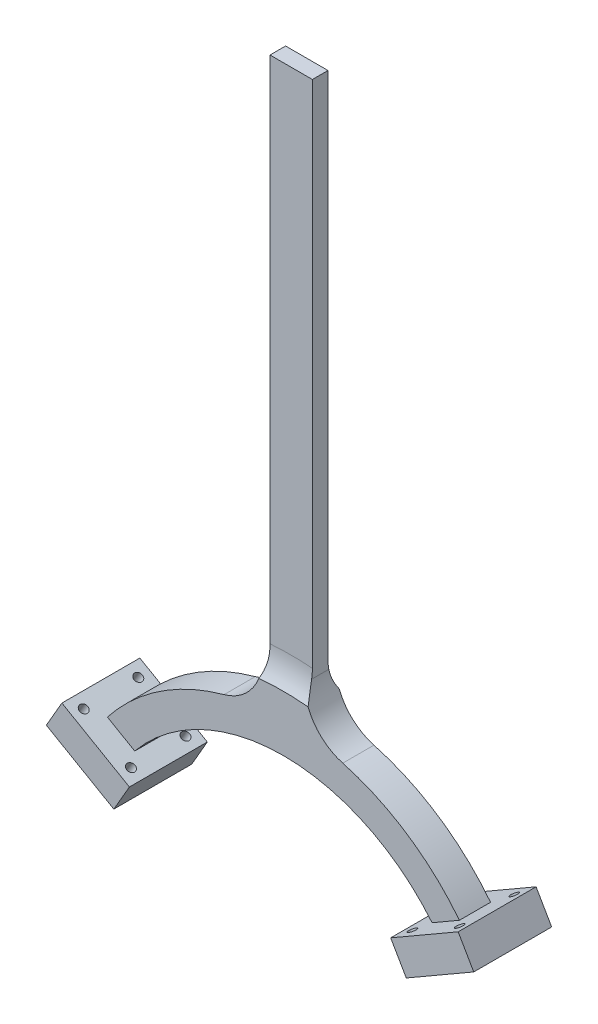
from build123d import *

# Parameters (mm, degrees)
SKETCH1_R                = 8.2
BOSS_EXTRUDE1_DEPTH      = 25
SKETCH2_W                = 40.79
SKETCH2_H                = 15
BOSS_EXTRUDE2_DEPTH      = 25
SKETCH3_R                = 12.5
BOSS_EXTRUDE4_DEPTH      = 25
BOSS_EXTRUDE5_REACH      = 51.448
SKETCH5_W                = 40.79
SKETCH5_H                = 15
BOSS_EXTRUDE7_DEPTH      = 1505
BOSS_EXTRUDE8_START      = -40.79
BOSS_EXTRUDE8_DEPTH      = 40.79
SKETCH9_W                = 15
SKETCH9_H                = 15
REVOLVE1_ANGLE           = 60
REVOLVE1_OTHER_WAY_ANGLE = 60
FILLET3_R                = 50
SKETCH11_W               = 75
SKETCH11_H               = 75
SKETCH11_R               = 4
BOSS_EXTRUDE9_DEPTH      = 30
CUT_EXTRUDE2_DEPTH       = 1755.203433898
SKETCH16_R               = 677.859439882
CUT_EXTRUDE3_DEPTH       = 1049.19413159


with BuildPart() as part:
    # Sketch1 → Boss-Extrude1 (new body)
    with BuildSketch(Plane(origin=(0, 0, 0), x_dir=(1, 0, 0), z_dir=(0, 1, 0))):
        with Locations(Location((0, 0, 0), (0, 0, 270))):
            Circle(SKETCH1_R)
    extrude(amount=BOSS_EXTRUDE1_DEPTH)

    # Sketch2 → Boss-Extrude2 (add)
    with BuildSketch(Plane(origin=(0, 0, 0), x_dir=(-1, 0, 0), z_dir=(0, -1, 0))):
        Rectangle(SKETCH2_W, SKETCH2_H)
    extrude(amount=BOSS_EXTRUDE2_DEPTH)

    # Sketch3 → Boss-Extrude4 (add)
    with BuildSketch(Plane(origin=(0, -25, 0), x_dir=(-1, 0, 0), z_dir=(0, -1, 0))):
        Circle(SKETCH3_R)
    extrude(amount=-BOSS_EXTRUDE4_DEPTH)

    # Boss-Extrude5: up to this face of the body (flat: up to its plane)
    boss_extrude5_end = Plane(part.part.faces().sort_by_distance((20.395, -12.5, 0))[0])
    # Sketch4 → Boss-Extrude5 (add, up to the picked face)
    with BuildSketch(Plane.ZY.offset(20.395), mode=Mode.PRIVATE) as boss_extrude5_sk1:
        Polygon((192.5, -225), (-7.5, -25), (7.5, -25), (207.5, -225), align=None)
    boss_extrude5_tool1 = split(extrude(boss_extrude5_sk1.sketch, amount=-BOSS_EXTRUDE5_REACH, mode=Mode.PRIVATE), bisect_by=boss_extrude5_end, keep=Keep.BOTH, mode=Mode.PRIVATE)
    add(boss_extrude5_tool1.solids().sort_by(Axis((-20.395, -125, 100), (1, 0, 0)))[0])

    # Sketch5 → Boss-Extrude7 (add)
    with BuildSketch(Plane(origin=(0, -225, 0), x_dir=(-1, 0, 0), z_dir=(0, -1, 0))):
        with Locations((0, -200)):
            Rectangle(SKETCH5_W, SKETCH5_H)
    extrude(amount=BOSS_EXTRUDE7_DEPTH)

    # Sketch7 → Boss-Extrude8 (add)
    with BuildSketch(Plane(origin=(20.395, 0, 0), x_dir=(0, 0, -1), z_dir=(1, 0, 0)).offset(BOSS_EXTRUDE8_START)):
        Polygon((1.552099385, -34.052099385), (0, -32.5), (-192.5, -225), (-192.5, -228.104198769), align=None)
        Polygon((7.5, -25), (0, -32.5), (1.552099385, -34.052099385), (7.5, -28.104198769), align=None)
        Polygon((-9.052099385, -23.447900615), (-207.5, -221.895801231), (-207.5, -225), (-7.5, -25), align=None)
        Polygon((-9.052099385, -23.447900615), (-7.5, -25), (-7.5, -21.895801231), align=None)
    extrude(amount=BOSS_EXTRUDE8_DEPTH)

    # Sketch9 → Revolve1 (revolve)
    with BuildSketch(Plane(origin=(0, 0, 0), x_dir=(0, 0, -1), z_dir=(1, 0, 0))):
        with Locations((-207.5, -1522.5)):
            Rectangle(SKETCH9_W, SKETCH9_H)
        Polygon((-185, -1545), (-185, -1530), (-200, -1530), (-215, -1530), (-215, -1545), align=None)
        with Locations((-192.5, -1522.5)):
            Rectangle(SKETCH9_W, SKETCH9_H)
    revolve(axis=Axis((0, -1730, 192.5), (0, 0, 1)), revolution_arc=REVOLVE1_ANGLE)

    # Sketch9 → Revolve1 other way (revolve)
    with BuildSketch(Plane(origin=(0, 0, 0), x_dir=(0, 0, -1), z_dir=(1, 0, 0))):
        with Locations((-207.5, -1522.5)):
            Rectangle(SKETCH9_W, SKETCH9_H)
        Polygon((-185, -1545), (-185, -1530), (-200, -1530), (-215, -1530), (-215, -1545), align=None)
        with Locations((-192.5, -1522.5)):
            Rectangle(SKETCH9_W, SKETCH9_H)
    revolve(axis=Axis((0, -1730, 192.5), (0, 0, -1)), revolution_arc=REVOLVE1_OTHER_WAY_ANGLE)

    # Fillet3
    # the kernel refuses this fillet: 50 mm, written as the material it adds along each edge
    with BuildSketch(Plane(origin=(0, -1730, 207.5), x_dir=(0.6259913130832682, 0.7798300301631668, 0), z_dir=(0.7798300301631668, -0.6259913130832682, 0))) as fillet3_piece_1_section:
        with BuildLine():
            CenterArc((215 + FILLET3_R, FILLET3_R), FILLET3_R, 180, 90)
            Line((215, FILLET3_R), (215, 0))
            Line((215, 0), (215 + FILLET3_R, 0))
        make_face()
    fillet3_piece_1 = revolve(axis=Axis((0, -1730, 207.5), (0, 0, 1)), revolution_arc=77.509968484, mode=Mode.PRIVATE)
    fillet3_piece_1 = split(fillet3_piece_1, bisect_by=Plane(origin=(20.395, -1497.728593149, 210.201005202), z_dir=(-1, 0, 0)), keep=Keep.TOP, mode=Mode.PRIVATE)
    fillet3_piece_1 = split(fillet3_piece_1, bisect_by=Plane(origin=(-20.395, -1497.728593149, 210.201005202), z_dir=(1, 0, 0)), keep=Keep.TOP, mode=Mode.PRIVATE)
    fillet3_piece_1 = split(fillet3_piece_1, bisect_by=Plane(origin=(0, -1497.728593149, 215), z_dir=(0, 0, -1)), keep=Keep.TOP, mode=Mode.PRIVATE)
    add(fillet3_piece_1)
    with BuildSketch(Plane(origin=(-20.395, -1515.969525593, 192.5), x_dir=(-0.9834951946600375, -0.1809342479482942, 0), z_dir=(0, 0, 1))) as fillet3_piece_2:
        with BuildLine():
            CenterArc((41.675293239, -49.811185367), FILLET3_R, 94.980893043, 74.594925131)
            Line((-7.499466494, -40.764472969), (0, 0))
            ThreePointArc((0, 0), (18.66705843, -0.811902923), (37.33411686, 0))
        make_face()
    extrude(amount=15)
    with BuildSketch(Plane(origin=(0, -1730, 192.5), x_dir=(0.6259913130832687, 0.7798300301631664, 0), z_dir=(0.7798300301631664, -0.6259913130832687, 0))) as fillet3_piece_3_section:
        with BuildLine():
            CenterArc((215 + FILLET3_R, -FILLET3_R), FILLET3_R, 90, 90)
            Line((215 + FILLET3_R, 0), (215, 0))
            Line((215, 0), (215, -FILLET3_R))
        make_face()
    fillet3_piece_3 = revolve(axis=Axis((0, -1730, 192.5), (0, 0, 1)), revolution_arc=77.509968484, mode=Mode.PRIVATE)
    fillet3_piece_3 = split(fillet3_piece_3, bisect_by=Plane(origin=(0, -1497.728593149, 185), z_dir=(0, 0, 1)), keep=Keep.TOP, mode=Mode.PRIVATE)
    fillet3_piece_3 = split(fillet3_piece_3, bisect_by=Plane(origin=(-20.395, -1497.728593149, 189.798994798), z_dir=(1, 0, 0)), keep=Keep.TOP, mode=Mode.PRIVATE)
    fillet3_piece_3 = split(fillet3_piece_3, bisect_by=Plane(origin=(20.395, -1497.728593149, 189.798994798), z_dir=(-1, 0, 0)), keep=Keep.TOP, mode=Mode.PRIVATE)
    add(fillet3_piece_3)
    with BuildSketch(Plane(origin=(20.395, -1515.969525593, 192.5), x_dir=(0.9834951946600374, -0.18093424794829469, 0), z_dir=(0, 0, 1))) as fillet3_piece_4:
        with BuildLine():
            CenterArc((41.675293239, 49.811185367), FILLET3_R, 190.424181826, 74.594925131)
            Line((-7.499466494, 40.764472969), (0, 0))
            ThreePointArc((0, 0), (18.66705843, 0.811902923), (37.33411686, 0))
        make_face()
    extrude(amount=15)
    with BuildSketch(Plane(origin=(0, -1730, 207.5), x_dir=(0.6259913130832682, 0.7798300301631668, 0), z_dir=(0.7798300301631668, -0.6259913130832682, 0))) as fillet3_piece_5a_section:
        with BuildLine():
            CenterArc((215 + FILLET3_R, FILLET3_R), FILLET3_R, 180, 90)
            Line((215, FILLET3_R), (215, 0))
            Line((215, 0), (215 + FILLET3_R, 0))
        make_face()
    fillet3_piece_5a = revolve(axis=Axis((0, -1730, 207.5), (0, 0, 1)), revolution_arc=77.509968484, mode=Mode.PRIVATE)
    fillet3_piece_5a = split(fillet3_piece_5a, bisect_by=Plane(origin=(20.395, -1516.663886588, 210.150724115), z_dir=(1, 0, 0)), keep=Keep.TOP, mode=Mode.PRIVATE)
    fillet3_piece_5a = split(fillet3_piece_5a, bisect_by=Plane(origin=(85.698064456, -1516.663886588, 215), z_dir=(0, 0, -1)), keep=Keep.TOP, mode=Mode.PRIVATE)
    with BuildSketch(Plane(origin=(20.395, -1515.969525593, 192.5), x_dir=(0.9834951946600374, -0.18093424794829469, 0), z_dir=(0, 0, 1))) as fillet3_piece_5b_section:
        with BuildLine():
            CenterArc((41.675293239, 49.811185367), FILLET3_R, 190.424181826, 74.594925131)
            Line((-7.499466494, 40.764472969), (0, 0))
            ThreePointArc((0, 0), (18.66705843, 0.811902923), (37.33411686, 0))
        make_face()
    fillet3_piece_5b = extrude(amount=118.621434021, mode=Mode.PRIVATE)
    fillet3_piece_5b = split(fillet3_piece_5b, bisect_by=Plane(origin=(28.539652215, -1507.603520272, 207.5), z_dir=(0, 0, 1)), keep=Keep.TOP, mode=Mode.PRIVATE)
    fillet3_piece_5b = split(fillet3_piece_5b, bisect_by=Plane(origin=(28.539652215, -1507.603520272, 215), z_dir=(0, 0, -1)), keep=Keep.TOP, mode=Mode.PRIVATE)
    fillet3_piece_5 = fillet3_piece_5a & fillet3_piece_5b
    add(fillet3_piece_5)
    with BuildSketch(Plane(origin=(0, -1730, 207.5), x_dir=(0.6259913130832682, 0.7798300301631668, 0), z_dir=(0.7798300301631668, -0.6259913130832682, 0))) as fillet3_piece_6a_section:
        with BuildLine():
            CenterArc((215 + FILLET3_R, FILLET3_R), FILLET3_R, 180, 90)
            Line((215, FILLET3_R), (215, 0))
            Line((215, 0), (215 + FILLET3_R, 0))
        make_face()
    fillet3_piece_6a = revolve(axis=Axis((0, -1730, 207.5), (0, 0, 1)), revolution_arc=77.509968484, mode=Mode.PRIVATE)
    fillet3_piece_6a = split(fillet3_piece_6a, bisect_by=Plane(origin=(-20.395, -1516.663887252, 210.150724175), z_dir=(-1, 0, 0)), keep=Keep.TOP, mode=Mode.PRIVATE)
    fillet3_piece_6a = split(fillet3_piece_6a, bisect_by=Plane(origin=(-85.69806423, -1516.663887252, 215), z_dir=(0, 0, -1)), keep=Keep.TOP, mode=Mode.PRIVATE)
    with BuildSketch(Plane(origin=(-20.395, -1515.969525593, 192.5), x_dir=(-0.9834951946600375, -0.1809342479482942, 0), z_dir=(0, 0, 1))) as fillet3_piece_6b_section:
        with BuildLine():
            CenterArc((41.675293239, -49.811185367), FILLET3_R, 94.980893043, 74.594925131)
            Line((-7.499466494, -40.764472969), (0, 0))
            ThreePointArc((0, 0), (18.66705843, -0.811902923), (37.33411686, 0))
        make_face()
    fillet3_piece_6b = extrude(amount=118.621434021, mode=Mode.PRIVATE)
    fillet3_piece_6b = split(fillet3_piece_6b, bisect_by=Plane(origin=(-28.539652215, -1507.603520272, 207.5), z_dir=(0, 0, 1)), keep=Keep.TOP, mode=Mode.PRIVATE)
    fillet3_piece_6b = split(fillet3_piece_6b, bisect_by=Plane(origin=(-28.539652215, -1507.603520272, 215), z_dir=(0, 0, -1)), keep=Keep.TOP, mode=Mode.PRIVATE)
    fillet3_piece_6 = fillet3_piece_6a & fillet3_piece_6b
    add(fillet3_piece_6)
    with BuildSketch(Plane(origin=(0, -1730, 192.5), x_dir=(0.6259913130832687, 0.7798300301631664, 0), z_dir=(0.7798300301631664, -0.6259913130832687, 0))) as fillet3_piece_7a_section:
        with BuildLine():
            CenterArc((215 + FILLET3_R, -FILLET3_R), FILLET3_R, 90, 90)
            Line((215 + FILLET3_R, 0), (215, 0))
            Line((215, 0), (215, -FILLET3_R))
        make_face()
    fillet3_piece_7a = revolve(axis=Axis((0, -1730, 192.5), (0, 0, 1)), revolution_arc=77.509968484, mode=Mode.PRIVATE)
    fillet3_piece_7a = split(fillet3_piece_7a, bisect_by=Plane(origin=(-85.69806423, -1516.663887252, 185), z_dir=(0, 0, 1)), keep=Keep.TOP, mode=Mode.PRIVATE)
    fillet3_piece_7a = split(fillet3_piece_7a, bisect_by=Plane(origin=(-20.395, -1516.663887252, 189.849275825), z_dir=(-1, 0, 0)), keep=Keep.TOP, mode=Mode.PRIVATE)
    with BuildSketch(Plane(origin=(-20.395, -1515.969525593, 88.878565979), x_dir=(-0.9834951946600375, -0.1809342479482942, 0), z_dir=(0, 0, 1))) as fillet3_piece_7b_section:
        with BuildLine():
            CenterArc((41.675293239, -49.811185367), FILLET3_R, 94.980893043, 74.594925131)
            Line((-7.499466494, -40.764472969), (0, 0))
            ThreePointArc((0, 0), (18.66705843, -0.811902923), (37.33411686, 0))
        make_face()
    fillet3_piece_7b = extrude(amount=118.621434021, mode=Mode.PRIVATE)
    fillet3_piece_7b = split(fillet3_piece_7b, bisect_by=Plane(origin=(-28.539652215, -1507.603520272, 185), z_dir=(0, 0, 1)), keep=Keep.TOP, mode=Mode.PRIVATE)
    fillet3_piece_7b = split(fillet3_piece_7b, bisect_by=Plane(origin=(-28.539652215, -1507.603520272, 192.5), z_dir=(0, 0, -1)), keep=Keep.TOP, mode=Mode.PRIVATE)
    fillet3_piece_7 = fillet3_piece_7a & fillet3_piece_7b
    add(fillet3_piece_7)
    with BuildSketch(Plane(origin=(0, -1730, 192.5), x_dir=(0.6259913130832687, 0.7798300301631664, 0), z_dir=(0.7798300301631664, -0.6259913130832687, 0))) as fillet3_piece_8a_section:
        with BuildLine():
            CenterArc((215 + FILLET3_R, -FILLET3_R), FILLET3_R, 90, 90)
            Line((215 + FILLET3_R, 0), (215, 0))
            Line((215, 0), (215, -FILLET3_R))
        make_face()
    fillet3_piece_8a = revolve(axis=Axis((0, -1730, 192.5), (0, 0, 1)), revolution_arc=77.509968484, mode=Mode.PRIVATE)
    fillet3_piece_8a = split(fillet3_piece_8a, bisect_by=Plane(origin=(85.698064456, -1516.663886588, 185), z_dir=(0, 0, 1)), keep=Keep.TOP, mode=Mode.PRIVATE)
    fillet3_piece_8a = split(fillet3_piece_8a, bisect_by=Plane(origin=(20.395, -1516.663886588, 189.849275885), z_dir=(1, 0, 0)), keep=Keep.TOP, mode=Mode.PRIVATE)
    with BuildSketch(Plane(origin=(20.395, -1515.969525593, 88.878565979), x_dir=(0.9834951946600374, -0.1809342479482948, 0), z_dir=(0, 0, 1))) as fillet3_piece_8b_section:
        with BuildLine():
            CenterArc((41.675293239, 49.811185367), FILLET3_R, 190.424181826, 74.594925131)
            Line((-7.499466494, 40.764472969), (0, 0))
            ThreePointArc((0, 0), (18.66705843, 0.811902923), (37.33411686, 0))
        make_face()
    fillet3_piece_8b = extrude(amount=118.621434021, mode=Mode.PRIVATE)
    fillet3_piece_8b = split(fillet3_piece_8b, bisect_by=Plane(origin=(28.539652215, -1507.603520272, 185), z_dir=(0, 0, 1)), keep=Keep.TOP, mode=Mode.PRIVATE)
    fillet3_piece_8b = split(fillet3_piece_8b, bisect_by=Plane(origin=(28.539652215, -1507.603520272, 192.5), z_dir=(0, 0, -1)), keep=Keep.TOP, mode=Mode.PRIVATE)
    fillet3_piece_8 = fillet3_piece_8a & fillet3_piece_8b
    add(fillet3_piece_8)

    # Sketch11 → Boss-Extrude9 (add)
    with BuildSketch(Plane(origin=(749.111974274, -1297.5, 0), x_dir=(-0.8660254037844398, -0.49999999999999806, 0), z_dir=(0.499999999999998, -0.8660254037844397, 0))):
        with Locations((665, -200)):
            Rectangle(SKETCH11_W, SKETCH11_H)
        with Locations(Location((638.75, -173.75, 0), (0, 0, 180))):
            Circle(SKETCH11_R, mode=Mode.SUBTRACT)
        with Locations(Location((691.25, -173.75, 0), (0, 0, 180))):
            Circle(SKETCH11_R, mode=Mode.SUBTRACT)
        with Locations(Location((691.25, -226.25, 0), (0, 0, 180))):
            Circle(SKETCH11_R, mode=Mode.SUBTRACT)
        with Locations(Location((638.75, -226.25, 0), (0, 0, 180))):
            Circle(SKETCH11_R, mode=Mode.SUBTRACT)
    boss_extrude9 = extrude(amount=-BOSS_EXTRUDE9_DEPTH)

    # Mirror1: Boss-Extrude9 across plane
    add(boss_extrude9.mirror(Plane(origin=(0, 0, 0), x_dir=(0, 0, 1), z_dir=(1, 0, 0))))

    # Sketch15 → Cut-Extrude2 (cut, through all)
    with BuildSketch(Plane(origin=(0, 0, 192.5), x_dir=(-1, 0, 0), z_dir=(0, 0, -1))):
        with BuildLine():
            Line((-20.395, -1730), (-20.395, -1546.127642167))
            ThreePointArc((-20.395, -1546.127642167), (0, -1545), (20.395, -1546.127642167))
            Line((20.395, -1546.127642167), (20.395, -1730))
            Line((20.395, -1730), (-20.395, -1730))
        make_face()
    extrude(amount=-CUT_EXTRUDE2_DEPTH, mode=Mode.SUBTRACT)

    # Sketch16 → Cut-Extrude3 (cut, through all)
    with BuildSketch(Plane(origin=(0, -975, 0), x_dir=(1, 0, 0), z_dir=(0, 1, 0))):
        Circle(SKETCH16_R)
    extrude(amount=CUT_EXTRUDE3_DEPTH, mode=Mode.SUBTRACT)


solid = part.part
